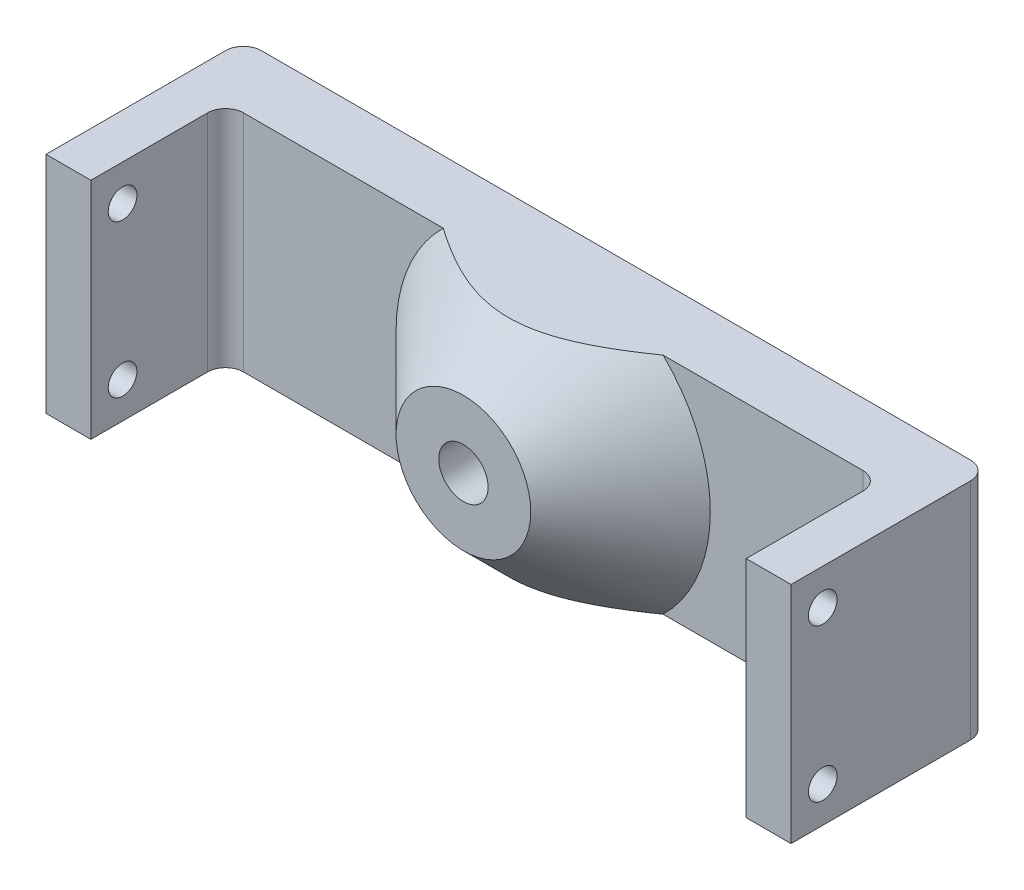
from build123d import *

# Parameters (mm, degrees)
SZKIC1_W                    = 83
SZKIC1_H                    = 25
DODANIE_WYCI_GNI_CIE1_DEPTH = 7
SZKIC2_W                    = 5
SZKIC2_H                    = 25
DODANIE_WYCI_GNI_CIE2_DEPTH = 15
WYTNIJ_WYCI_GNI_CIE1_REACH  = 88.771
SZKIC3_R                    = 1.6
SZKIC4_R                    = 7.5
DODANIE_WYCI_GNI_CIE4_DEPTH = 10
SZKIC5_R                    = 2.75
WYTNIJ_WYCI_GNI_CIE2_DEPTH  = 17
SFAZOWANIE1_SIZE            = 10
ZAOKR_GLENIE1_R             = 2
ZAOKR_GLENIE2_R             = 2


with BuildPart() as part:
    # Szkic1 → Dodanie-wyciągnięcie1 (new body)
    with BuildSketch(Plane.XY):
        Rectangle(SZKIC1_W, SZKIC1_H)
    extrude(amount=DODANIE_WYCI_GNI_CIE1_DEPTH)

    # Szkic2 → Dodanie-wyciągnięcie2 (add)
    with BuildSketch(Plane.XY.offset(7)):
        with Locations((-39, 0)):
            Rectangle(SZKIC2_W, SZKIC2_H)
        with Locations((39, 0)):
            Rectangle(SZKIC2_W, SZKIC2_H)
    extrude(amount=DODANIE_WYCI_GNI_CIE2_DEPTH)

    # Wytnij-wyciągnięcie1: up to this face of the body (flat: up to its plane)
    wytnij_wyci_gni_cie1_end = Plane(part.part.faces().sort_by_distance((-41.5, 0, 11))[0])
    # Szkic3 → Wytnij-wyciągnięcie1 (cut, up to the picked face)
    with BuildSketch(Plane(origin=(41.5, 0, 0), x_dir=(0, 0, -1), z_dir=(1, 0, 0)), mode=Mode.PRIVATE) as wytnij_wyci_gni_cie1_sk1:
        with Locations((-18.470012568, 8.5)):
            Circle(SZKIC3_R)
    wytnij_wyci_gni_cie1_tool1 = split(extrude(wytnij_wyci_gni_cie1_sk1.sketch, amount=-WYTNIJ_WYCI_GNI_CIE1_REACH, mode=Mode.PRIVATE), bisect_by=wytnij_wyci_gni_cie1_end, keep=Keep.BOTH, mode=Mode.PRIVATE)
    # Szkic3 → Wytnij-wyciągnięcie1 (cut, up to the picked face)
    with BuildSketch(Plane(origin=(41.5, 0, 0), x_dir=(0, 0, -1), z_dir=(1, 0, 0)), mode=Mode.PRIVATE) as wytnij_wyci_gni_cie1_sk2:
        with Locations((-18.470012568, -8.5)):
            Circle(SZKIC3_R)
    wytnij_wyci_gni_cie1_tool2 = split(extrude(wytnij_wyci_gni_cie1_sk2.sketch, amount=-WYTNIJ_WYCI_GNI_CIE1_REACH, mode=Mode.PRIVATE), bisect_by=wytnij_wyci_gni_cie1_end, keep=Keep.BOTH, mode=Mode.PRIVATE)
    add(wytnij_wyci_gni_cie1_tool1.solids().sort_by(Axis((41.5, 8.5, 18.470013), (-1, 0, 0)))[0], mode=Mode.SUBTRACT)
    add(wytnij_wyci_gni_cie1_tool2.solids().sort_by(Axis((41.5, -8.5, 18.470013), (-1, 0, 0)))[0], mode=Mode.SUBTRACT)

    # Szkic4 → Dodanie-wyciągnięcie4 (add)
    with BuildSketch(Plane.XY.offset(7)):
        with Locations(Location((0, 0, 0), (0, 0, 180))):
            Circle(SZKIC4_R)
    extrude(amount=DODANIE_WYCI_GNI_CIE4_DEPTH)

    # Szkic5 → Wytnij-wyciągnięcie2 (cut)
    with BuildSketch(Plane.XY.offset(17)):
        Circle(SZKIC5_R)
    extrude(amount=-WYTNIJ_WYCI_GNI_CIE2_DEPTH, mode=Mode.SUBTRACT)

    # Sfazowanie1
    # the kernel refuses this chamfer: 10 mm, written as the material it adds along each edge
    with BuildSketch(Plane(origin=(0, 0, 7), x_dir=(-1, 0, 0), z_dir=(0, 1, 0))) as sfazowanie1_piece_1_section:
        Polygon((7.5 + SFAZOWANIE1_SIZE, 0), (7.5, SFAZOWANIE1_SIZE), (7.5, 0), align=None)
    sfazowanie1_piece_1 = revolve(axis=Axis((0, 0, 7), (0, 0, 1)), mode=Mode.PRIVATE)
    sfazowanie1_piece_1 = split(sfazowanie1_piece_1, bisect_by=Plane(origin=(12.53571583, 12.5, 11.752873117), z_dir=(0, -1, 0)), keep=Keep.TOP, mode=Mode.PRIVATE)
    sfazowanie1_piece_1 = split(sfazowanie1_piece_1, bisect_by=Plane(origin=(12.53571583, -12.5, 11.752873117), z_dir=(0, 1, 0)), keep=Keep.TOP, mode=Mode.PRIVATE)
    sfazowanie1_piece_1 = split(sfazowanie1_piece_1, bisect_by=Plane(origin=(12.53571583, 0, 17), z_dir=(0, 0, -1)), keep=Keep.TOP, mode=Mode.PRIVATE)
    add(sfazowanie1_piece_1)

    # Zaokrąglenie1
    zaokr_glenie1_edges = [part.edges().sort_by_distance(p)[0] for p in [
        (-36.5, 0, 7),
        (36.5, 0, 7),
    ]]
    fillet(zaokr_glenie1_edges, radius=ZAOKR_GLENIE1_R)

    # Zaokrąglenie2
    zaokr_glenie2_edges = [part.edges().sort_by_distance(p)[0] for p in [
        (41.5, 0, 0),
        (-41.5, 0, 0),
    ]]
    fillet(zaokr_glenie2_edges, radius=ZAOKR_GLENIE2_R)


solid = part.part
